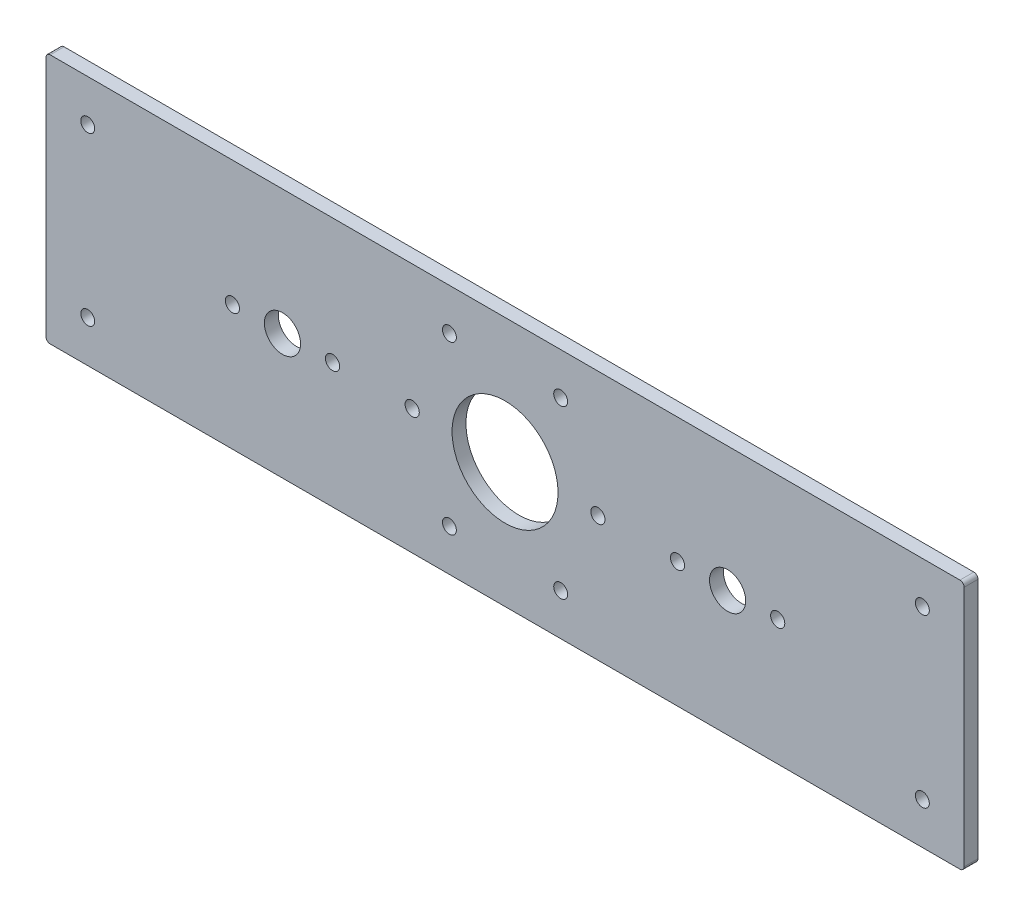
from build123d import *

# Parameters (mm, degrees)
SKETCH1_W           = 330
SKETCH1_H           = 90
SKETCH1_R           = 19.05
SKETCH1_R_2         = 2.55
BOSS_EXTRUDE1_DEPTH = 2.5
SKETCH2_R           = 2.5
CUT_EXTRUDE1_DEPTH  = 172.099386323
SKETCH3_R           = 2.55
SKETCH3_R_2         = 6.5
CUT_EXTRUDE2_DEPTH  = 172.099386323
FILLET1_R           = 1.5


with BuildPart() as part:
    # Sketch1 → Boss-Extrude1 (new, symmetric)
    with BuildSketch(Plane.XY):
        Rectangle(SKETCH1_W, SKETCH1_H)
        Circle(SKETCH1_R, mode=Mode.SUBTRACT)
        with Locations((-33.375440072, 0)):
            Circle(SKETCH1_R_2, mode=Mode.SUBTRACT)
        with Locations((33.375440072, 0)):
            Circle(SKETCH1_R_2, mode=Mode.SUBTRACT)
    extrude(amount=BOSS_EXTRUDE1_DEPTH, both=True)

    # Sketch2 → Cut-Extrude1 (cut, through all)
    with BuildSketch(Plane.XY.offset(2.5)):
        with Locations((-150, 30)):
            Circle(SKETCH2_R)
        with Locations((-150, -30)):
            Circle(SKETCH2_R)
        with Locations((-20, 30)):
            Circle(SKETCH2_R)
        with Locations((-20, -30)):
            Circle(SKETCH2_R)
        with Locations((20, -30)):
            Circle(SKETCH2_R)
        with Locations((20, 30)):
            Circle(SKETCH2_R)
        with Locations((150, 30)):
            Circle(SKETCH2_R)
        with Locations((150, -30)):
            Circle(SKETCH2_R)
    extrude(amount=-CUT_EXTRUDE1_DEPTH, mode=Mode.SUBTRACT)

    # Sketch3 → Cut-Extrude2 (cut, through all)
    with BuildSketch(Plane.XY.offset(2.5)):
        with Locations((-62, 0)):
            Circle(SKETCH3_R)
        with Locations((-98, 0)):
            Circle(SKETCH3_R)
        with Locations((-80, 0)):
            Circle(SKETCH3_R_2)
    cut_extrude2 = extrude(amount=-CUT_EXTRUDE2_DEPTH, mode=Mode.SUBTRACT)

    # Mirror1: Cut-Extrude2 across plane
    add(cut_extrude2.mirror(Plane(origin=(0, 0, 0), x_dir=(0, 0, 1), z_dir=(1, 0, 0))), mode=Mode.SUBTRACT)

    # Fillet1
    fillet1_edges = [part.edges().sort_by_distance(p)[0] for p in [
        (-165, -45, 0),
        (165, -45, 0),
        (165, 45, 0),
        (-165, 45, 0),
    ]]
    fillet(fillet1_edges, radius=FILLET1_R)


solid = part.part
